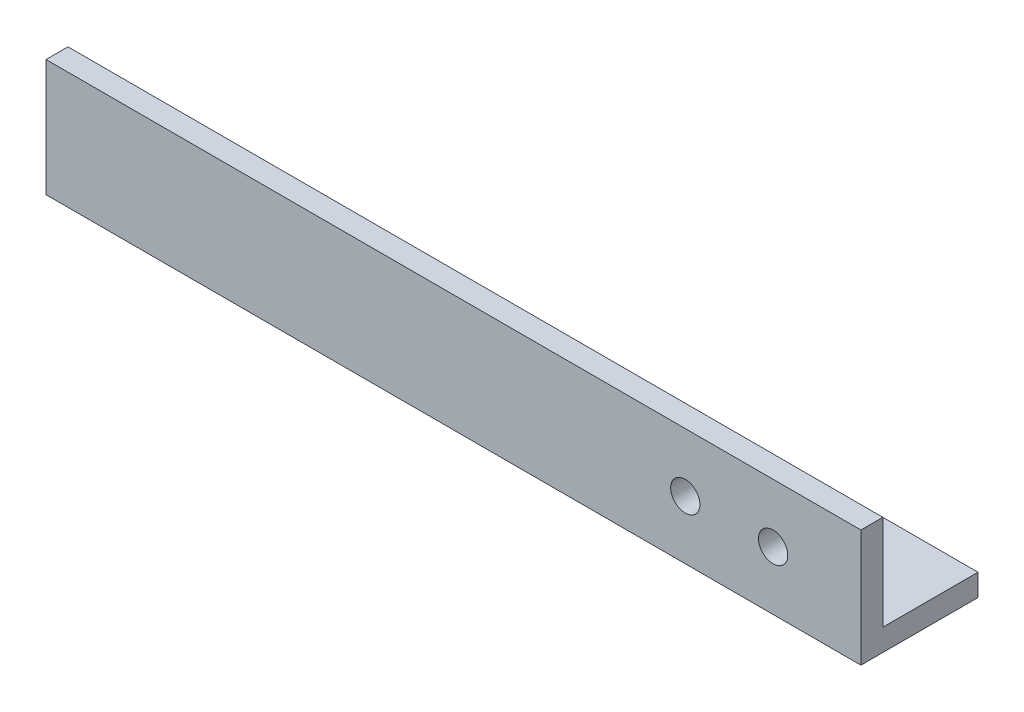
from build123d import *

# Parameters (mm, degrees)
BOSS_EXTRUDE1_DEPTH = 176.784
CUT_EXTRUDE1_REACH  = 181.788
SKETCH2_R           = 3.175
CUT_EXTRUDE2_REACH  = 182.397
SKETCH3_R           = 3.175
CUT_EXTRUDE3_REACH  = 182.397
SKETCH6_R           = 3.175


with BuildPart() as part:
    # Sketch1 → Boss-Extrude1 (new body)
    with BuildSketch(Plane(origin=(0, 0, 0), x_dir=(0, 0, -1), z_dir=(1, 0, 0))):
        Polygon((0, 0), (0, -25.4), (25.4, -25.4), (25.4, -20.6375), (4.7625, -20.6375), (4.7625, 0), align=None)
    extrude(amount=BOSS_EXTRUDE1_DEPTH)

    # Sketch2 → Cut-Extrude1 (cut, up to next)
    with BuildSketch(Plane(origin=(0, -20.6375, 0), x_dir=(1, 0, 0), z_dir=(0, 1, 0)), mode=Mode.PRIVATE) as cut_extrude1_sk1:
        with Locations((9.525, 11.1125)):
            Circle(SKETCH2_R)
    cut_extrude1_tool1 = extrude(cut_extrude1_sk1.sketch, amount=-CUT_EXTRUDE1_REACH, mode=Mode.PRIVATE) & part.part
    # Sketch2 → Cut-Extrude1 (cut, up to next)
    with BuildSketch(Plane(origin=(0, -20.6375, 0), x_dir=(1, 0, 0), z_dir=(0, 1, 0)), mode=Mode.PRIVATE) as cut_extrude1_sk2:
        with Locations((19.05, 17.4625)):
            Circle(SKETCH2_R)
    cut_extrude1_tool2 = extrude(cut_extrude1_sk2.sketch, amount=-CUT_EXTRUDE1_REACH, mode=Mode.PRIVATE) & part.part
    add(cut_extrude1_tool1.solids().sort_by_distance((9.525, -20.6375, -11.1125))[0], mode=Mode.SUBTRACT)
    add(cut_extrude1_tool2.solids().sort_by_distance((19.05, -20.6375, -17.4625))[0], mode=Mode.SUBTRACT)

    # Sketch3 → Cut-Extrude2 (cut, up to next)
    with BuildSketch(Plane.XZ.offset(25.4), mode=Mode.PRIVATE) as cut_extrude2_sk1:
        with Locations((112.253201513, -13.470384182)):
            Circle(SKETCH3_R)
    cut_extrude2_tool1 = extrude(cut_extrude2_sk1.sketch, amount=-CUT_EXTRUDE2_REACH, mode=Mode.PRIVATE) & part.part
    add(cut_extrude2_tool1.solids().sort_by_distance((112.253202, -25.4, -13.470384))[0], mode=Mode.SUBTRACT)

    # Sketch6 → Cut-Extrude3 (cut, up to next)
    with BuildSketch(Plane.XY, mode=Mode.PRIVATE) as cut_extrude3_sk1:
        with Locations((138.684, -12.7)):
            Circle(SKETCH6_R)
    cut_extrude3_tool1 = extrude(cut_extrude3_sk1.sketch, amount=-CUT_EXTRUDE3_REACH, mode=Mode.PRIVATE) & part.part
    # Sketch6 → Cut-Extrude3 (cut, up to next)
    with BuildSketch(Plane.XY, mode=Mode.PRIVATE) as cut_extrude3_sk2:
        with Locations((157.734, -12.7)):
            Circle(SKETCH6_R)
    cut_extrude3_tool2 = extrude(cut_extrude3_sk2.sketch, amount=-CUT_EXTRUDE3_REACH, mode=Mode.PRIVATE) & part.part
    add(cut_extrude3_tool1.solids().sort_by_distance((138.684, -12.7, 0))[0], mode=Mode.SUBTRACT)
    add(cut_extrude3_tool2.solids().sort_by_distance((157.734, -12.7, 0))[0], mode=Mode.SUBTRACT)


solid = part.part
